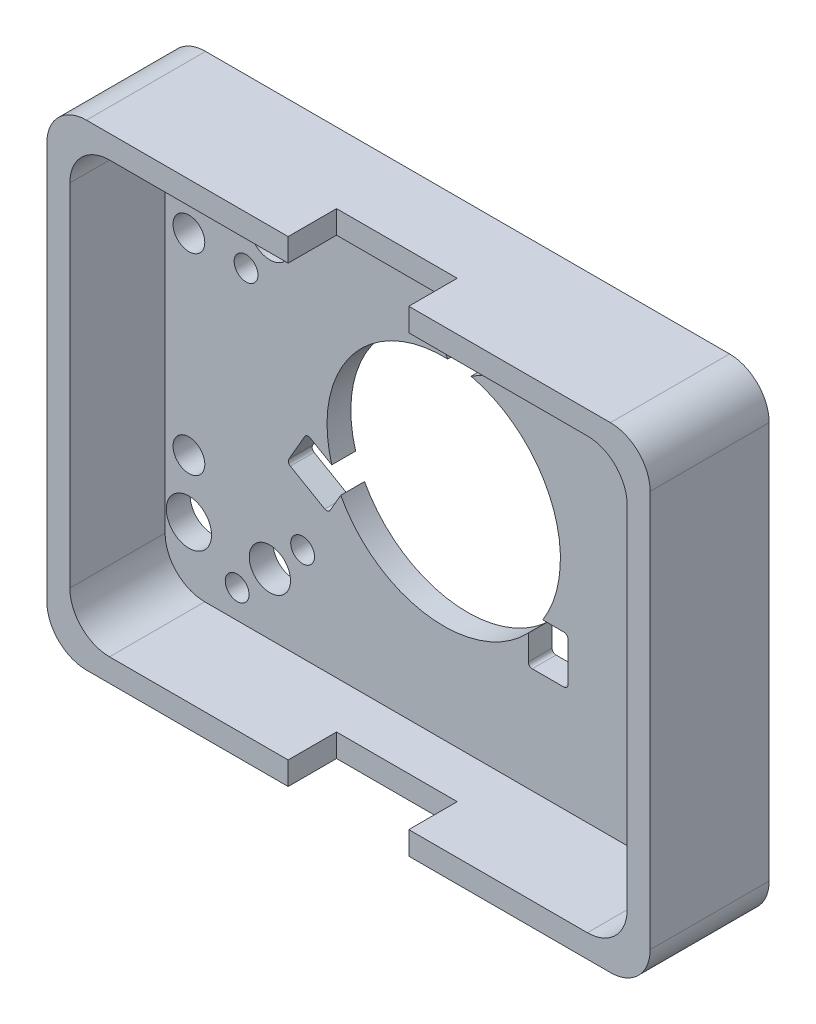
from build123d import *

# Parameters (mm, degrees)
EXTRUDE_1_DEPTH     = 15
CUT_EXTRUDE_1_DEPTH = 12
SKETCH_4_W          = 15.2
SKETCH_4_H          = 2.9
CUT_EXTRUDE_2_DEPTH = 6.1
SKETCH_5_R          = 2.85
SKETCH_5_R_2        = 2
CUT_EXTRUDE_3_DEPTH = 50.879855653
SKETCH_8_R          = 2.6
CUT_EXTRUDE_4_DEPTH = 50.879855653
CUT_EXTRUDE_5_REACH = 52.685
SKETCH_9_R          = 1.5


with BuildPart() as part:
    # 草圖1 → 填料-伸長1 (new body)
    with BuildSketch(Plane.XY):
        with BuildLine():
            Line((-33, 30), (33, 30))
            ThreePointArc((33, 30), (36.535533906, 28.535533906), (38, 25))
            Line((38, 25), (38, -25))
            ThreePointArc((38, -25), (36.535533906, -28.535533906), (33, -30))
            Line((33, -30), (-33, -30))
            ThreePointArc((-33, -30), (-36.535533906, -28.535533906), (-38, -25))
            Line((-38, -25), (-38, 25))
            ThreePointArc((-38, 25), (-36.535533906, 28.535533906), (-33, 30))
        make_face()
    extrude(amount=EXTRUDE_1_DEPTH)

    # 草圖2 → 除料-伸長1 (cut)
    with BuildSketch(Plane.XY.offset(15)):
        with BuildLine():
            Line((-30.1, 27.1), (30.1, 27.1))
            ThreePointArc((30.1, 27.1), (33.635533906, 25.635533906), (35.1, 22.1))
            Line((35.1, 22.1), (35.1, -22.1))
            ThreePointArc((35.1, -22.1), (33.635533906, -25.635533906), (30.1, -27.1))
            Line((30.1, -27.1), (-30.1, -27.1))
            ThreePointArc((-30.1, -27.1), (-33.635533906, -25.635533906), (-35.1, -22.1))
            Line((-35.1, -22.1), (-35.1, 22.1))
            ThreePointArc((-35.1, 22.1), (-33.635533906, 25.635533906), (-30.1, 27.1))
        make_face()
    extrude(amount=-CUT_EXTRUDE_1_DEPTH, mode=Mode.SUBTRACT)

    # 草圖3 → 除料-旋轉1 (revolve, cut)
    with BuildSketch(Plane(origin=(0, 0, 0), x_dir=(1, 0, 0), z_dir=(0, 1, 0))):
        Polygon((0, -3), (14.7, -3), (14.7, -1.9), (14.7, 0), (0, 0), (0, -1.9), align=None)
    revolve(axis=Axis((0, 0, -11.605627028), (0, 0, 1)), mode=Mode.SUBTRACT)

    # 草圖4 → 除料-伸長2 (cut)
    with BuildSketch(Plane.XY.offset(15)):
        with Locations((0, 28.55)):
            Rectangle(SKETCH_4_W, SKETCH_4_H)
        with Locations((0, -28.55)):
            Rectangle(SKETCH_4_W, SKETCH_4_H)
    extrude(amount=-CUT_EXTRUDE_2_DEPTH, mode=Mode.SUBTRACT)

    # 草圖5 → 除料-伸長3 (cut, through all)
    with BuildSketch(Plane.XY.offset(3)):
        with BuildLine():
            ThreePointArc((-19.508830064, -6.230284867), (-19.558780275, -6.60969439), (-19.325817362, -6.913297569))
            Line((-19.325817362, -6.913297569), (-14.995690343, -9.413297569))
            ThreePointArc((-14.995690343, -9.413297569), (-14.616280821, -9.46324778), (-14.312677641, -9.230284867))
            Line((-14.312677641, -9.230284867), (-12.312677641, -5.766183252))
            ThreePointArc((-12.312677641, -5.766183252), (-12.26272743, -5.38677373), (-12.495690343, -5.08317055))
            Line((-12.495690343, -5.08317055), (-16.825817362, -2.58317055))
            ThreePointArc((-16.825817362, -2.58317055), (-17.205226885, -2.533220339), (-17.508830064, -2.766183252))
            Line((-17.508830064, -2.766183252), (-19.508830064, -6.230284867))
        make_face()
        with BuildLine():
            Line((15.15, -7.78), (11.15, -7.78))
            ThreePointArc((11.15, -7.78), (10.796446609, -7.926446609), (10.65, -8.28))
            Line((10.65, -8.28), (10.65, -13.28))
            ThreePointArc((10.65, -13.28), (10.796446609, -13.633553391), (11.15, -13.78))
            Line((11.15, -13.78), (15.15, -13.78))
            ThreePointArc((15.15, -13.78), (15.503553391, -13.633553391), (15.65, -13.28))
            Line((15.65, -13.28), (15.65, -8.28))
            ThreePointArc((15.65, -8.28), (15.503553391, -7.926446609), (15.15, -7.78))
        make_face()
        with BuildLine():
            Line((1.845690343, 13.36317055), (6.175817362, 15.86317055))
            ThreePointArc((6.175817362, 15.86317055), (6.408780275, 16.16677373), (6.358830064, 16.546183252))
            Line((6.358830064, 16.546183252), (4.358830064, 20.010284867))
            ThreePointArc((4.358830064, 20.010284867), (4.055226885, 20.24324778), (3.675817362, 20.193297569))
            Line((3.675817362, 20.193297569), (-0.654309657, 17.693297569))
            ThreePointArc((-0.654309657, 17.693297569), (-0.88727257, 17.38969439), (-0.837322359, 17.010284867))
            Line((-0.837322359, 17.010284867), (1.162677641, 13.546183252))
            ThreePointArc((1.162677641, 13.546183252), (1.466280821, 13.313220339), (1.845690343, 13.36317055))
        make_face()
        with Locations((-32.1, 19.4)):
            Circle(SKETCH_5_R)
        with Locations((32.1, 17.9)):
            Circle(SKETCH_5_R)
        with Locations((-32.1, -19.4)):
            Circle(SKETCH_5_R)
        with Locations((32.1, -19.4)):
            Circle(SKETCH_5_R)
        with Locations((-32.1, 12.1)):
            Circle(SKETCH_5_R_2)
        with Locations((32.1, 12.1)):
            Circle(SKETCH_5_R_2)
        with Locations((32.1, -12.1)):
            Circle(SKETCH_5_R_2)
        with Locations((-32.1, -12.1)):
            Circle(SKETCH_5_R_2)
    extrude(amount=-CUT_EXTRUDE_3_DEPTH, mode=Mode.SUBTRACT)

    # 草圖8 → 除料-伸長4 (cut, through all)
    with BuildSketch(Plane.XY.offset(3)):
        with Locations((-21.9, -19.4)):
            Circle(SKETCH_8_R)
        with Locations((21.9, 16.9)):
            Circle(SKETCH_8_R)
        with Locations((-21.9, 16.9)):
            Circle(SKETCH_8_R)
    extrude(amount=-CUT_EXTRUDE_4_DEPTH, mode=Mode.SUBTRACT)

    # 草圖9 → 除料-伸長5 (cut, up to next)
    with BuildSketch(Plane(origin=(0, 0, 0), x_dir=(-1, 0, 0), z_dir=(0, 0, -1)), mode=Mode.PRIVATE) as cut_extrude_5_sk1:
        with Locations((-18.9, 21.9)):
            Circle(SKETCH_9_R)
    cut_extrude_5_tool1 = extrude(cut_extrude_5_sk1.sketch, amount=-CUT_EXTRUDE_5_REACH, mode=Mode.PRIVATE) & part.part
    # 草圖9 → 除料-伸長5 (cut, up to next)
    with BuildSketch(Plane(origin=(0, 0, 0), x_dir=(-1, 0, 0), z_dir=(0, 0, -1)), mode=Mode.PRIVATE) as cut_extrude_5_sk2:
        with Locations((-24.9, 11.9)):
            Circle(SKETCH_9_R)
    cut_extrude_5_tool2 = extrude(cut_extrude_5_sk2.sketch, amount=-CUT_EXTRUDE_5_REACH, mode=Mode.PRIVATE) & part.part
    # 草圖9 → 除料-伸長5 (cut, up to next)
    with BuildSketch(Plane(origin=(0, 0, 0), x_dir=(-1, 0, 0), z_dir=(0, 0, -1)), mode=Mode.PRIVATE) as cut_extrude_5_sk3:
        with Locations((24.9, 11.9)):
            Circle(SKETCH_9_R)
    cut_extrude_5_tool3 = extrude(cut_extrude_5_sk3.sketch, amount=-CUT_EXTRUDE_5_REACH, mode=Mode.PRIVATE) & part.part
    # 草圖9 → 除料-伸長5 (cut, up to next)
    with BuildSketch(Plane(origin=(0, 0, 0), x_dir=(-1, 0, 0), z_dir=(0, 0, -1)), mode=Mode.PRIVATE) as cut_extrude_5_sk4:
        with Locations((18.9, 21.9)):
            Circle(SKETCH_9_R)
    cut_extrude_5_tool4 = extrude(cut_extrude_5_sk4.sketch, amount=-CUT_EXTRUDE_5_REACH, mode=Mode.PRIVATE) & part.part
    # 草圖9 → 除料-伸長5 (cut, up to next)
    with BuildSketch(Plane(origin=(0, 0, 0), x_dir=(-1, 0, 0), z_dir=(0, 0, -1)), mode=Mode.PRIVATE) as cut_extrude_5_sk5:
        with Locations((17.776894374, -15.276894374)):
            Circle(SKETCH_9_R)
    cut_extrude_5_tool5 = extrude(cut_extrude_5_sk5.sketch, amount=-CUT_EXTRUDE_5_REACH, mode=Mode.PRIVATE) & part.part
    # 草圖9 → 除料-伸長5 (cut, up to next)
    with BuildSketch(Plane(origin=(0, 0, 0), x_dir=(-1, 0, 0), z_dir=(0, 0, -1)), mode=Mode.PRIVATE) as cut_extrude_5_sk6:
        with Locations((26.023105626, -23.523105626)):
            Circle(SKETCH_9_R)
    cut_extrude_5_tool6 = extrude(cut_extrude_5_sk6.sketch, amount=-CUT_EXTRUDE_5_REACH, mode=Mode.PRIVATE) & part.part
    add(cut_extrude_5_tool1.solids().sort_by_distance((18.9, 21.9, 0))[0], mode=Mode.SUBTRACT)
    add(cut_extrude_5_tool2.solids().sort_by_distance((24.9, 11.9, 0))[0], mode=Mode.SUBTRACT)
    add(cut_extrude_5_tool3.solids().sort_by_distance((-24.9, 11.9, 0))[0], mode=Mode.SUBTRACT)
    add(cut_extrude_5_tool4.solids().sort_by_distance((-18.9, 21.9, 0))[0], mode=Mode.SUBTRACT)
    add(cut_extrude_5_tool5.solids().sort_by_distance((-17.776894, -15.276894, 0))[0], mode=Mode.SUBTRACT)
    add(cut_extrude_5_tool6.solids().sort_by_distance((-26.023106, -23.523106, 0))[0], mode=Mode.SUBTRACT)


solid = part.part
